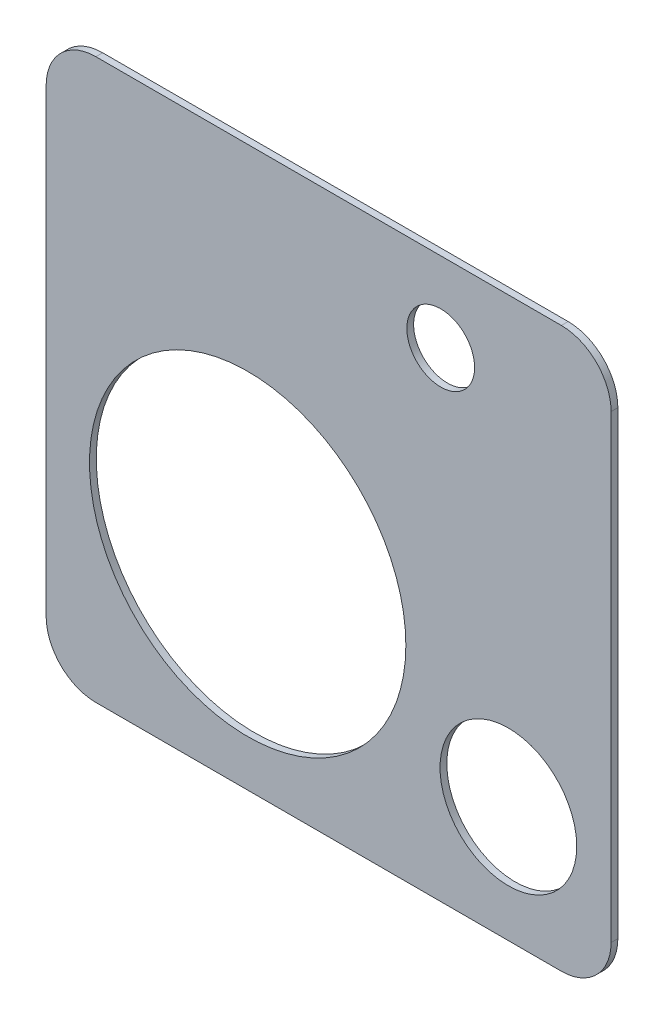
from build123d import *

# Parameters (mm, degrees)
SKETCH1_W           = 500
SKETCH1_H           = 495
BOSS_EXTRUDE1_DEPTH = 6
FILLET1_R           = 44
SKETCH3_R           = 140
CUT_EXTRUDE2_DEPTH  = 704.60571345
SKETCH5_R           = 60.5
CUT_EXTRUDE3_DEPTH  = 704.60571345
SKETCH6_R           = 30
CUT_EXTRUDE5_DEPTH  = 704.60571345


with BuildPart() as part:
    # Sketch1 → Boss-Extrude1 (new body)
    with BuildSketch(Plane.XY):
        with Locations((250, 247.5)):
            Rectangle(SKETCH1_W, SKETCH1_H)
    extrude(amount=BOSS_EXTRUDE1_DEPTH)

    # Fillet1
    fillet1_edges = [part.edges().sort_by_distance(p)[0] for p in [
        (0, 0, 3),
        (500, 0, 3),
        (0, 495, 3),
        (500, 495, 3),
    ]]
    fillet(fillet1_edges, radius=FILLET1_R)

    # Sketch3 → Cut-Extrude2 (cut, through all)
    with BuildSketch(Plane.XY.offset(6)):
        with Locations((178.369044072, 181.034738009)):
            Circle(SKETCH3_R)
    extrude(amount=-CUT_EXTRUDE2_DEPTH, mode=Mode.SUBTRACT)

    # Sketch5 → Cut-Extrude3 (cut, through all)
    with BuildSketch(Plane.XY.offset(6)):
        with Locations((409.103373264, 102.516190165)):
            Circle(SKETCH5_R)
    extrude(amount=-CUT_EXTRUDE3_DEPTH, mode=Mode.SUBTRACT)

    # Sketch6 → Cut-Extrude5 (cut, through all)
    with BuildSketch(Plane.XY.offset(6)):
        with Locations((349.228645131, 424.382672345)):
            Circle(SKETCH6_R)
    extrude(amount=-CUT_EXTRUDE5_DEPTH, mode=Mode.SUBTRACT)


solid = part.part
